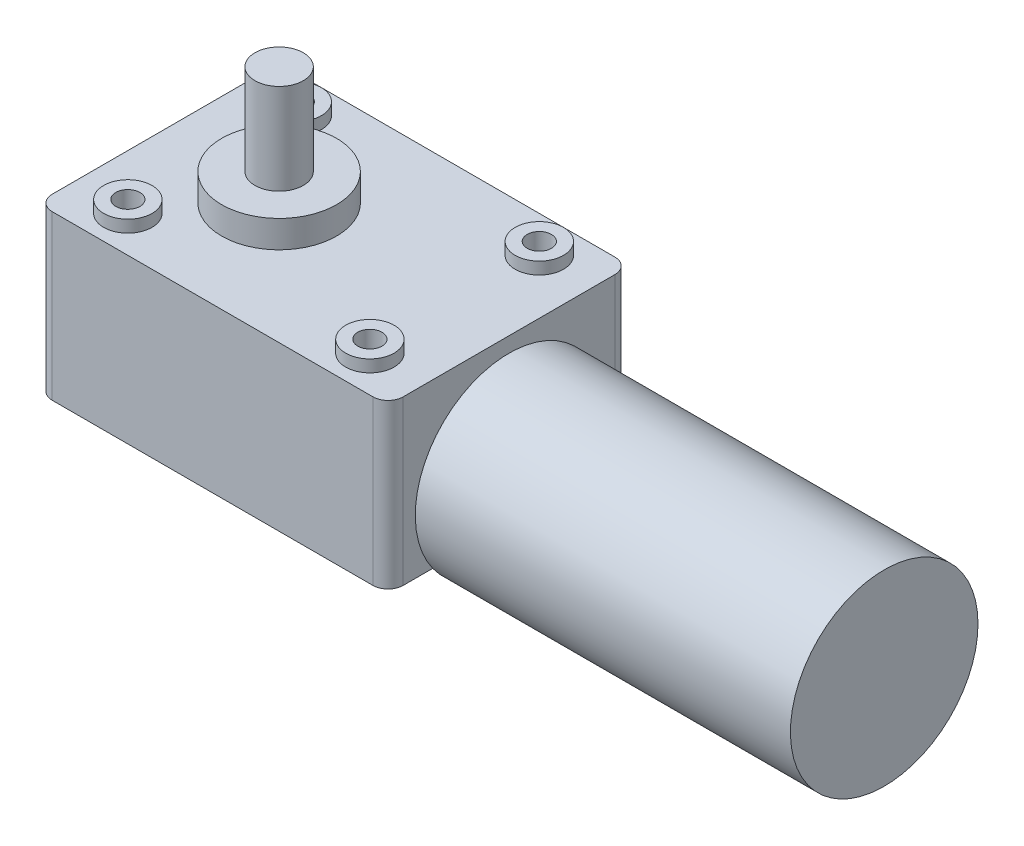
from build123d import *

# Parameters (mm, degrees)
BOSS_EXTRUDE1_DEPTH = 13.5
SKETCH2_R           = 4
BOSS_EXTRUDE2_DEPTH = 2
SKETCH3_R           = 2
CUT_EXTRUDE1_DEPTH  = 6
SKETCH6_R           = 9.5
BOSS_EXTRUDE5_DEPTH = 4.5
SKETCH4_R           = 4
BOSS_EXTRUDE3_DEPTH = 15
SKETCH5_R           = 15.5
BOSS_EXTRUDE4_DEPTH = 62
SKETCH7_R           = 4
CUT_EXTRUDE2_DEPTH  = 1.7


with BuildPart() as part:
    # Sketch1 → Boss-Extrude1 (new, symmetric)
    with BuildSketch(Plane(origin=(0, 0, 0), x_dir=(1, 0, 0), z_dir=(0, 1, 0))):
        with BuildLine():
            Line((-26.5, -20), (26.5, -20))
            ThreePointArc((26.5, -20), (28.267766953, -19.267766953), (29, -17.5))
            Line((29, -17.5), (29, 17.5))
            ThreePointArc((29, 17.5), (28.267766953, 19.267766953), (26.5, 20))
            Line((26.5, 20), (-26.5, 20))
            ThreePointArc((-26.5, 20), (-28.267766953, 19.267766953), (-29, 17.5))
            Line((-29, 17.5), (-29, -17.5))
            ThreePointArc((-29, -17.5), (-28.267766953, -19.267766953), (-26.5, -20))
        make_face()
    extrude(amount=BOSS_EXTRUDE1_DEPTH, both=True)

    # Sketch2 → Boss-Extrude2 (add)
    with BuildSketch(Plane(origin=(0, 13.5, 0), x_dir=(1, 0, 0), z_dir=(0, 1, 0))):
        with Locations((-20, 14)):
            Circle(SKETCH2_R)
        with Locations((-20, -14)):
            Circle(SKETCH2_R)
        with Locations((20, -14)):
            Circle(SKETCH2_R)
        with Locations((20, 14)):
            Circle(SKETCH2_R)
    boss_extrude2 = extrude(amount=BOSS_EXTRUDE2_DEPTH)

    # Sketch3 → Cut-Extrude1 (cut)
    with BuildSketch(Plane(origin=(0, 15.5, 0), x_dir=(1, 0, 0), z_dir=(0, 1, 0))):
        with Locations((-20, 14)):
            Circle(SKETCH3_R)
        with Locations((20, 14)):
            Circle(SKETCH3_R)
        with Locations((20, -14)):
            Circle(SKETCH3_R)
        with Locations((-20, -14)):
            Circle(SKETCH3_R)
    cut_extrude1 = extrude(amount=-CUT_EXTRUDE1_DEPTH, mode=Mode.SUBTRACT)

    # Sketch6 → Boss-Extrude5 (add)
    with BuildSketch(Plane(origin=(0, 13.5, 0), x_dir=(1, 0, 0), z_dir=(0, 1, 0))):
        with Locations((-9, 0)):
            Circle(SKETCH6_R)
    boss_extrude5 = extrude(amount=BOSS_EXTRUDE5_DEPTH)

    # Sketch4 → Boss-Extrude3 (add)
    with BuildSketch(Plane(origin=(0, 18, 0), x_dir=(1, 0, 0), z_dir=(0, 1, 0))):
        with Locations((-9, 0)):
            Circle(SKETCH4_R)
    extrude(amount=BOSS_EXTRUDE3_DEPTH)

    # Sketch5 → Boss-Extrude4 (add)
    with BuildSketch(Plane(origin=(29, 0, 0), x_dir=(0, 0, -1), z_dir=(1, 0, 0))):
        with Locations((0, -4.5)):
            Circle(SKETCH5_R)
    extrude(amount=BOSS_EXTRUDE4_DEPTH)

    # Mirror2: Boss-Extrude2, Cut-Extrude1, Boss-Extrude5 across plane
    add(boss_extrude2.mirror(Plane.ZX))
    add(cut_extrude1.mirror(Plane.ZX), mode=Mode.SUBTRACT)
    add(boss_extrude5.mirror(Plane.ZX))

    # Sketch7 → Cut-Extrude2 (cut)
    with BuildSketch(Plane.XZ.offset(18)):
        with Locations((-9, 0)):
            Circle(SKETCH7_R)
    extrude(amount=-CUT_EXTRUDE2_DEPTH, mode=Mode.SUBTRACT)


solid = part.part
